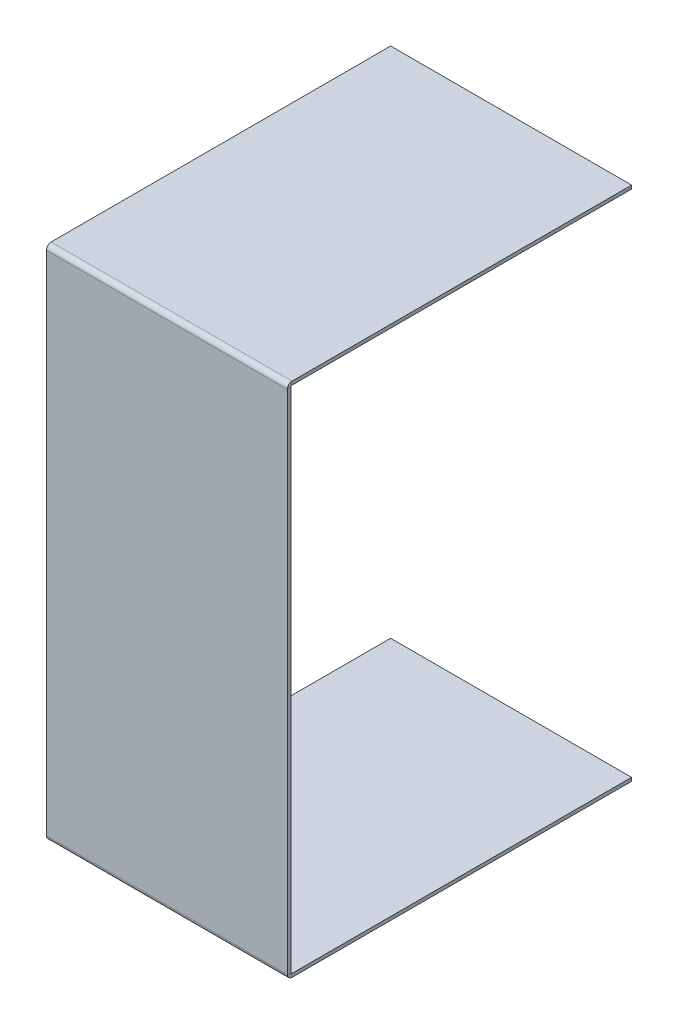
from build123d import *

# Parameters (mm, degrees)
SKETCH1_W                    = 140
SKETCH1_H                    = 300
BASE_FLANGE1_DEPTH           = 2
EDGE_FLANGE1_STRIP_W         = 9.4732
EDGE_FLANGE1_STRIP_H         = 2
EDGE_FLANGE1_STRIP_CUT_DEPTH = 140
EDGE_FLANGE1_DEPTH           = 140
EDGE_FLANGE2_STRIP_W         = 9.4732
EDGE_FLANGE2_STRIP_H         = 2
EDGE_FLANGE2_STRIP_CUT_DEPTH = 140
EDGE_FLANGE2_DEPTH           = 140


# Sheet-metal steps are written as plain solids
with BuildPart() as part:
    # Sketch1 → Base-Flange1 (new body)
    with BuildSketch(Plane.XY):
        with Locations((-441.560693642, 8.670520231)):
            Rectangle(SKETCH1_W, SKETCH1_H)
    extrude(amount=-BASE_FLANGE1_DEPTH)

    # Edge-Flange1 strip (across the edge) → Edge-Flange1 strip cut (cut)
    with BuildSketch(Plane(origin=(-511.560693642, 158.670520231, -2), x_dir=(0, -1, 0), z_dir=(1, 0, 0))):
        with Locations((-2, -1)):
            Rectangle(EDGE_FLANGE1_STRIP_W, EDGE_FLANGE1_STRIP_H)
    extrude(amount=EDGE_FLANGE1_STRIP_CUT_DEPTH, mode=Mode.SUBTRACT)

    # Edge-Flange1 section (across the edge) → Edge-Flange1 (add)
    with BuildSketch(Plane(origin=(-511.560693642, 158.670520231, -2), x_dir=(0, -1, 0), z_dir=(1, 0, 0))):
        with BuildLine():
            Line((0, 0.7366), (0, 198))
            Line((0, 198), (2, 198))
            Line((2, 198), (2, 0.7366))
            ThreePointArc((2, 0.7366), (2.215745145, 0.215745145), (2.7366, 0))
            Line((2.7366, 0), (2.7366, -2))
            ThreePointArc((2.7366, -2), (0.801531583, -1.198468417), (0, 0.7366))
        make_face()
    extrude(amount=EDGE_FLANGE1_DEPTH)

    # Edge-Flange2 strip (across the edge) → Edge-Flange2 strip cut (cut)
    with BuildSketch(Plane(origin=(-371.560693642, -141.329479769, -2), x_dir=(0, 1, 0), z_dir=(-1, 0, 0))):
        with Locations((-2, -1)):
            Rectangle(EDGE_FLANGE2_STRIP_W, EDGE_FLANGE2_STRIP_H)
    extrude(amount=EDGE_FLANGE2_STRIP_CUT_DEPTH, mode=Mode.SUBTRACT)

    # Edge-Flange2 section (across the edge) → Edge-Flange2 (add)
    with BuildSketch(Plane(origin=(-371.560693642, -141.329479769, -2), x_dir=(0, 1, 0), z_dir=(-1, 0, 0))):
        with BuildLine():
            Line((0, 0.7366), (0, 198))
            Line((0, 198), (2, 198))
            Line((2, 198), (2, 0.7366))
            ThreePointArc((2, 0.7366), (2.215745145, 0.215745145), (2.7366, 0))
            Line((2.7366, 0), (2.7366, -2))
            ThreePointArc((2.7366, -2), (0.801531583, -1.198468417), (0, 0.7366))
        make_face()
    extrude(amount=EDGE_FLANGE2_DEPTH)


solid = part.part
